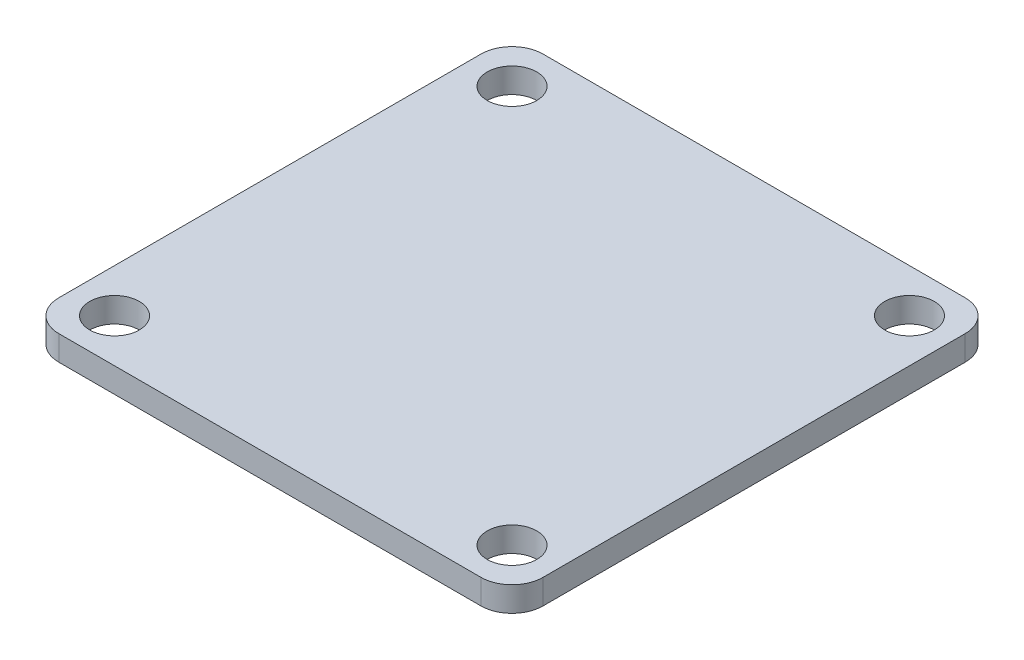
from build123d import *

# Parameters (mm, degrees)
SKETCH_1_R             = 8
SM_BASE_FLANGE_1_DEPTH = 8


# Sheet-metal steps are written as plain solids
with BuildPart() as part:
    # Sketch 1 → Базовая кромка1 (new body)
    with BuildSketch(Plane(origin=(0, 0, 0), x_dir=(1, 0, 0), z_dir=(0, 1, 0))):
        with BuildLine():
            Line((-78.142135624, -68.142135624), (-78.142135624, 68.142135624))
            ThreePointArc((-78.142135624, 68.142135624), (-75.213203436, 75.213203436), (-68.142135624, 78.142135624))
            Line((-68.142135624, 78.142135624), (68.142135624, 78.142135624))
            ThreePointArc((68.142135624, 78.142135624), (75.213203436, 75.213203436), (78.142135624, 68.142135624))
            Line((78.142135624, 68.142135624), (78.142135624, -68.142135624))
            ThreePointArc((78.142135624, -68.142135624), (75.213203436, -75.213203436), (68.142135624, -78.142135624))
            Line((68.142135624, -78.142135624), (-68.142135624, -78.142135624))
            ThreePointArc((-68.142135624, -78.142135624), (-75.213203436, -75.213203436), (-78.142135624, -68.142135624))
        make_face()
        with Locations(Location((64.142135624, 64.142135624, 0), (0, 0, 270))):
            Circle(SKETCH_1_R, mode=Mode.SUBTRACT)
        with Locations(Location((64.142135624, -64.142135624, 0), (0, 0, 270))):
            Circle(SKETCH_1_R, mode=Mode.SUBTRACT)
        with Locations(Location((-64.142135624, -64.142135624, 0), (0, 0, 270))):
            Circle(SKETCH_1_R, mode=Mode.SUBTRACT)
        with Locations(Location((-64.142135624, 64.142135624, 0), (0, 0, 270))):
            Circle(SKETCH_1_R, mode=Mode.SUBTRACT)
    extrude(amount=SM_BASE_FLANGE_1_DEPTH)


solid = part.part
